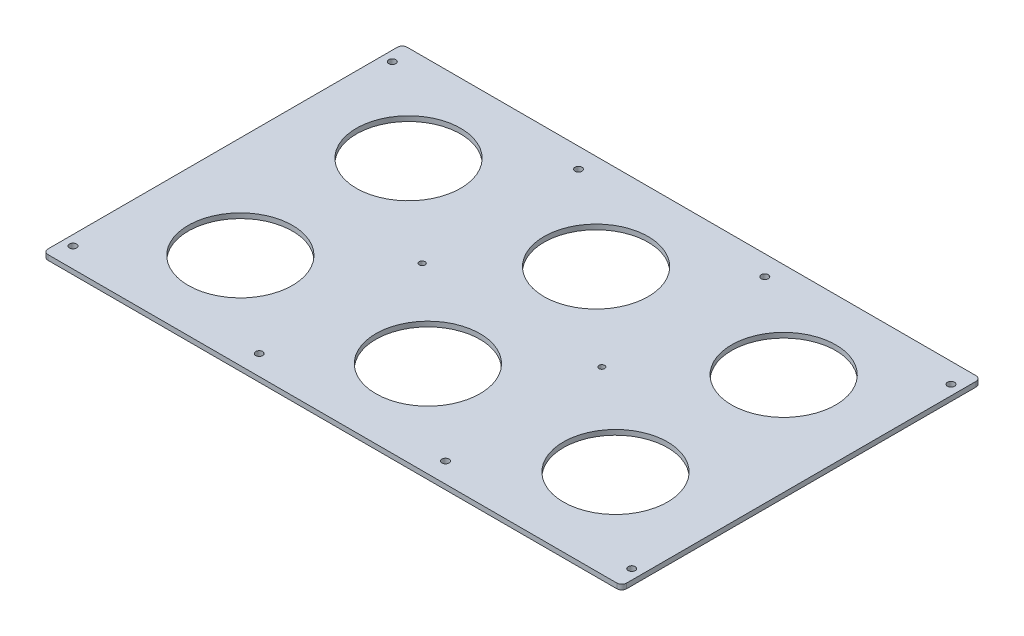
from build123d import *

# Parameters (mm, degrees)
SKETCH1_R           = 33.147
SKETCH1_R_2         = 2.2479
SKETCH1_R_3         = 1.8288
BOSS_EXTRUDE1_DEPTH = 3.175


with BuildPart() as part:
    # Sketch1 → Boss-Extrude1 (new body)
    with BuildSketch(Plane(origin=(0, 0, 0), x_dir=(1, 0, 0), z_dir=(0, 1, 0))):
        with BuildLine():
            Line((-180.975, 114.3), (180.975, 114.3))
            ThreePointArc((180.975, 114.3), (183.22006403, 113.37006403), (184.15, 111.125))
            Line((184.15, 111.125), (184.15, -111.125))
            ThreePointArc((184.15, -111.125), (183.22006403, -113.37006403), (180.975, -114.3))
            Line((180.975, -114.3), (-180.975, -114.3))
            ThreePointArc((-180.975, -114.3), (-183.22006403, -113.37006403), (-184.15, -111.125))
            Line((-184.15, -111.125), (-184.15, 111.125))
            ThreePointArc((-184.15, 111.125), (-183.22006403, 113.37006403), (-180.975, 114.3))
        make_face()
        with Locations((119.38, -53.5178)):
            Circle(SKETCH1_R, mode=Mode.SUBTRACT)
        with Locations((-177.8, -101.6)):
            Circle(SKETCH1_R_2, mode=Mode.SUBTRACT)
        with Locations((-59.266666667, -101.6)):
            Circle(SKETCH1_R_2, mode=Mode.SUBTRACT)
        with Locations((59.266666667, -101.6)):
            Circle(SKETCH1_R_2, mode=Mode.SUBTRACT)
        with Locations((177.8, -101.6)):
            Circle(SKETCH1_R_2, mode=Mode.SUBTRACT)
        with Locations((177.8, 101.6)):
            Circle(SKETCH1_R_2, mode=Mode.SUBTRACT)
        with Locations((59.266666667, 101.6)):
            Circle(SKETCH1_R_2, mode=Mode.SUBTRACT)
        with Locations((-59.266666667, 101.6)):
            Circle(SKETCH1_R_2, mode=Mode.SUBTRACT)
        with Locations((-177.8, 101.6)):
            Circle(SKETCH1_R_2, mode=Mode.SUBTRACT)
        with Locations((-57.15, 0)):
            Circle(SKETCH1_R_3, mode=Mode.SUBTRACT)
        with Locations((57.15, 0)):
            Circle(SKETCH1_R_3, mode=Mode.SUBTRACT)
        with Locations((119.38, 53.5178)):
            Circle(SKETCH1_R, mode=Mode.SUBTRACT)
        with Locations((0, 53.5178)):
            Circle(SKETCH1_R, mode=Mode.SUBTRACT)
        with Locations((0, -53.5178)):
            Circle(SKETCH1_R, mode=Mode.SUBTRACT)
        with Locations((-119.38, 53.5178)):
            Circle(SKETCH1_R, mode=Mode.SUBTRACT)
        with Locations((-119.38, -53.5178)):
            Circle(SKETCH1_R, mode=Mode.SUBTRACT)
    extrude(amount=BOSS_EXTRUDE1_DEPTH)


solid = part.part
